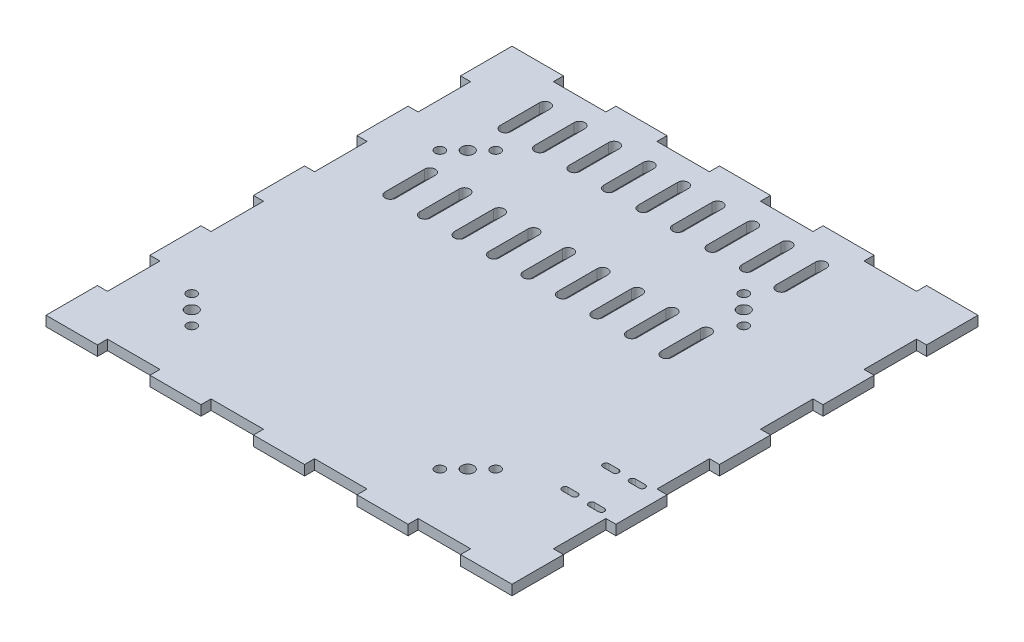
from build123d import *

# Parameters (mm, degrees)
SKETCH2_W           = 130
SKETCH2_H           = 130
SKETCH2_R           = 1.7
BOSS_EXTRUDE1_DEPTH = 2.8
CUT_EXTRUDE2_REACH  = 102.713
SKETCH5_R           = 1.35
SKETCH4_W           = 2.8
SKETCH4_H           = 14.444444445
SKETCH4_W_2         = 14.444444445
SKETCH4_H_2         = 2.8
CUT_EXTRUDE1_DEPTH  = 101.713020509
CUT_EXTRUDE3_REACH  = 102.713
CUT_EXTRUDE4_REACH  = 102.713
TOLERANCE_BY        = 0.1
TOLERANCE_2_BY      = 0.1
TOLERANCE_3_BY      = 0.1
TOLERANCE_4_BY      = 0.1
TOLERANCE_5_BY      = 0.1
TOLERANCE_6_BY      = 0.1
TOLERANCE_7_BY      = 0.1
TOLERANCE_8_BY      = 0.1
TOLERANCE_9_BY      = 0.1
TOLERANCE_10_BY     = 0.1
TOLERANCE_11_BY     = 0.1
TOLERANCE_12_BY     = 0.1
TOLERANCE_13_BY     = 0.1
TOLERANCE_14_BY     = 0.1
TOLERANCE_15_BY     = 0.1
TOLERANCE_16_BY     = 0.1
TOLERANCE_17_BY     = 0.1
TOLERANCE_18_BY     = 0.1
TOLERANCE_19_BY     = 0.1
TOLERANCE_20_BY     = 0.1
TOLERANCE_21_BY     = 0.1
TOLERANCE_22_BY     = 0.1
TOLERANCE_23_BY     = 0.1
TOLERANCE_24_BY     = 0.1
TOLERANCE_25_BY     = 0.1
TOLERANCE_26_BY     = 0.1
TOLERANCE_27_BY     = 0.1
TOLERANCE_28_BY     = 0.1
TOLERANCE_29_BY     = 0.1
TOLERANCE_30_BY     = 0.1
TOLERANCE_31_BY     = 0.1
TOLERANCE_32_BY     = 0.1


with BuildPart() as part:
    # Sketch2 → Boss-Extrude1 (new body)
    with BuildSketch(Plane(origin=(0, 0, 0), x_dir=(1, 0, 0), z_dir=(0, 1, 0))):
        with Locations((7.5, 4.85)):
            Rectangle(SKETCH2_W, SKETCH2_H)
        with Locations((-38.5, 38.5)):
            Circle(SKETCH2_R, mode=Mode.SUBTRACT)
        with Locations((-38.5, -38.5)):
            Circle(SKETCH2_R, mode=Mode.SUBTRACT)
        with Locations((38.5, -38.5)):
            Circle(SKETCH2_R, mode=Mode.SUBTRACT)
        with Locations((38.5, 38.5)):
            Circle(SKETCH2_R, mode=Mode.SUBTRACT)
    extrude(amount=BOSS_EXTRUDE1_DEPTH)

    # Sketch5 → Cut-Extrude2 (cut, up to next)
    with BuildSketch(Plane(origin=(0, 2.8, 0), x_dir=(1, 0, 0), z_dir=(0, 1, 0)), mode=Mode.PRIVATE) as cut_extrude2_sk1:
        with Locations((42.389087297, 34.610912703)):
            Circle(SKETCH5_R)
    cut_extrude2_tool1 = extrude(cut_extrude2_sk1.sketch, amount=-CUT_EXTRUDE2_REACH, mode=Mode.PRIVATE) & part.part
    # Sketch5 → Cut-Extrude2 (cut, up to next)
    with BuildSketch(Plane(origin=(0, 2.8, 0), x_dir=(1, 0, 0), z_dir=(0, 1, 0)), mode=Mode.PRIVATE) as cut_extrude2_sk2:
        with Locations((34.610912703, 42.389087297)):
            Circle(SKETCH5_R)
    cut_extrude2_tool2 = extrude(cut_extrude2_sk2.sketch, amount=-CUT_EXTRUDE2_REACH, mode=Mode.PRIVATE) & part.part
    # Sketch5 → Cut-Extrude2 (cut, up to next)
    with BuildSketch(Plane(origin=(0, 2.8, 0), x_dir=(1, 0, 0), z_dir=(0, 1, 0)), mode=Mode.PRIVATE) as cut_extrude2_sk3:
        with Locations((34.610912703, -42.389087297)):
            Circle(SKETCH5_R)
    cut_extrude2_tool3 = extrude(cut_extrude2_sk3.sketch, amount=-CUT_EXTRUDE2_REACH, mode=Mode.PRIVATE) & part.part
    # Sketch5 → Cut-Extrude2 (cut, up to next)
    with BuildSketch(Plane(origin=(0, 2.8, 0), x_dir=(1, 0, 0), z_dir=(0, 1, 0)), mode=Mode.PRIVATE) as cut_extrude2_sk4:
        with Locations((42.389087297, -34.610912703)):
            Circle(SKETCH5_R)
    cut_extrude2_tool4 = extrude(cut_extrude2_sk4.sketch, amount=-CUT_EXTRUDE2_REACH, mode=Mode.PRIVATE) & part.part
    # Sketch5 → Cut-Extrude2 (cut, up to next)
    with BuildSketch(Plane(origin=(0, 2.8, 0), x_dir=(1, 0, 0), z_dir=(0, 1, 0)), mode=Mode.PRIVATE) as cut_extrude2_sk5:
        with Locations((-42.389087297, -34.610912703)):
            Circle(SKETCH5_R)
    cut_extrude2_tool5 = extrude(cut_extrude2_sk5.sketch, amount=-CUT_EXTRUDE2_REACH, mode=Mode.PRIVATE) & part.part
    # Sketch5 → Cut-Extrude2 (cut, up to next)
    with BuildSketch(Plane(origin=(0, 2.8, 0), x_dir=(1, 0, 0), z_dir=(0, 1, 0)), mode=Mode.PRIVATE) as cut_extrude2_sk6:
        with Locations((-34.610912703, -42.389087297)):
            Circle(SKETCH5_R)
    cut_extrude2_tool6 = extrude(cut_extrude2_sk6.sketch, amount=-CUT_EXTRUDE2_REACH, mode=Mode.PRIVATE) & part.part
    # Sketch5 → Cut-Extrude2 (cut, up to next)
    with BuildSketch(Plane(origin=(0, 2.8, 0), x_dir=(1, 0, 0), z_dir=(0, 1, 0)), mode=Mode.PRIVATE) as cut_extrude2_sk7:
        with Locations((-34.610912703, 42.389087297)):
            Circle(SKETCH5_R)
    cut_extrude2_tool7 = extrude(cut_extrude2_sk7.sketch, amount=-CUT_EXTRUDE2_REACH, mode=Mode.PRIVATE) & part.part
    # Sketch5 → Cut-Extrude2 (cut, up to next)
    with BuildSketch(Plane(origin=(0, 2.8, 0), x_dir=(1, 0, 0), z_dir=(0, 1, 0)), mode=Mode.PRIVATE) as cut_extrude2_sk8:
        with Locations((-42.389087297, 34.610912703)):
            Circle(SKETCH5_R)
    cut_extrude2_tool8 = extrude(cut_extrude2_sk8.sketch, amount=-CUT_EXTRUDE2_REACH, mode=Mode.PRIVATE) & part.part
    add(cut_extrude2_tool1.solids().sort_by_distance((42.389087, 2.8, -34.610913))[0], mode=Mode.SUBTRACT)
    add(cut_extrude2_tool2.solids().sort_by_distance((34.610913, 2.8, -42.389087))[0], mode=Mode.SUBTRACT)
    add(cut_extrude2_tool3.solids().sort_by_distance((34.610913, 2.8, 42.389087))[0], mode=Mode.SUBTRACT)
    add(cut_extrude2_tool4.solids().sort_by_distance((42.389087, 2.8, 34.610913))[0], mode=Mode.SUBTRACT)
    add(cut_extrude2_tool5.solids().sort_by_distance((-42.389087, 2.8, 34.610913))[0], mode=Mode.SUBTRACT)
    add(cut_extrude2_tool6.solids().sort_by_distance((-34.610913, 2.8, 42.389087))[0], mode=Mode.SUBTRACT)
    add(cut_extrude2_tool7.solids().sort_by_distance((-34.610913, 2.8, -42.389087))[0], mode=Mode.SUBTRACT)
    add(cut_extrude2_tool8.solids().sort_by_distance((-42.389087, 2.8, -34.610913))[0], mode=Mode.SUBTRACT)

    # Sketch4 → Cut-Extrude1 (cut, through all)
    with BuildSketch(Plane(origin=(0, 2.8, 0), x_dir=(1, 0, 0), z_dir=(0, 1, 0))):
        with Locations((71.1, 48.183333334)):
            Rectangle(SKETCH4_W, SKETCH4_H)
        with Locations((71.1, 19.294444445)):
            Rectangle(SKETCH4_W, SKETCH4_H)
        with Locations((71.1, -9.594444445)):
            Rectangle(SKETCH4_W, SKETCH4_H)
        with Locations((71.1, -38.483333333)):
            Rectangle(SKETCH4_W, SKETCH4_H)
        with Locations((-35.833333334, -58.75)):
            Rectangle(SKETCH4_W_2, SKETCH4_H_2)
        with Locations((-6.944444445, -58.75)):
            Rectangle(SKETCH4_W_2, SKETCH4_H_2)
        with Locations((21.944444445, -58.75)):
            Rectangle(SKETCH4_W_2, SKETCH4_H_2)
        with Locations((50.833333334, -58.75)):
            Rectangle(SKETCH4_W_2, SKETCH4_H_2)
        with Locations((-56.1, 48.183333334)):
            Rectangle(SKETCH4_W, SKETCH4_H)
        with Locations((-56.1, 19.294444445)):
            Rectangle(SKETCH4_W, SKETCH4_H)
        with Locations((-56.1, -9.594444445)):
            Rectangle(SKETCH4_W, SKETCH4_H)
        with Locations((-56.1, -38.483333333)):
            Rectangle(SKETCH4_W, SKETCH4_H)
        with Locations((50.833333334, 68.45)):
            Rectangle(SKETCH4_W_2, SKETCH4_H_2)
        with Locations((21.944444445, 68.45)):
            Rectangle(SKETCH4_W_2, SKETCH4_H_2)
        with Locations((-6.944444445, 68.45)):
            Rectangle(SKETCH4_W_2, SKETCH4_H_2)
        with Locations((-35.833333334, 68.45)):
            Rectangle(SKETCH4_W_2, SKETCH4_H_2)
    extrude(amount=-CUT_EXTRUDE1_DEPTH, mode=Mode.SUBTRACT)

    # Sketch6 → Cut-Extrude3 (cut, up to next)
    with BuildSketch(Plane(origin=(0, 2.8, 0), x_dir=(1, 0, 0), z_dir=(0, 1, 0)), mode=Mode.PRIVATE) as cut_extrude3_sk1:
        with BuildLine():
            Line((67, -30.588888889), (64.3, -30.588888889))
            ThreePointArc((64.3, -30.588888889), (63.45, -29.738888889), (64.3, -28.888888889))
            Line((64.3, -28.888888889), (67, -28.888888889))
            ThreePointArc((67, -28.888888889), (67.85, -29.738888889), (67, -30.588888889))
        make_face()
    cut_extrude3_tool1 = extrude(cut_extrude3_sk1.sketch, amount=-CUT_EXTRUDE3_REACH, mode=Mode.PRIVATE) & part.part
    # Sketch6 → Cut-Extrude3 (cut, up to next)
    with BuildSketch(Plane(origin=(0, 2.8, 0), x_dir=(1, 0, 0), z_dir=(0, 1, 0)), mode=Mode.PRIVATE) as cut_extrude3_sk2:
        with BuildLine():
            Line((59.6, -30.588888889), (56.9, -30.588888889))
            ThreePointArc((56.9, -30.588888889), (56.05, -29.738888889), (56.9, -28.888888889))
            Line((56.9, -28.888888889), (59.6, -28.888888889))
            ThreePointArc((59.6, -28.888888889), (60.45, -29.738888889), (59.6, -30.588888889))
        make_face()
    cut_extrude3_tool2 = extrude(cut_extrude3_sk2.sketch, amount=-CUT_EXTRUDE3_REACH, mode=Mode.PRIVATE) & part.part
    # Sketch6 → Cut-Extrude3 (cut, up to next)
    with BuildSketch(Plane(origin=(0, 2.8, 0), x_dir=(1, 0, 0), z_dir=(0, 1, 0)), mode=Mode.PRIVATE) as cut_extrude3_sk3:
        with BuildLine():
            Line((59.6, -17.488888889), (56.9, -17.488888889))
            ThreePointArc((56.9, -17.488888889), (56.05, -18.338888889), (56.9, -19.188888889))
            Line((56.9, -19.188888889), (59.6, -19.188888889))
            ThreePointArc((59.6, -19.188888889), (60.45, -18.338888889), (59.6, -17.488888889))
        make_face()
    cut_extrude3_tool3 = extrude(cut_extrude3_sk3.sketch, amount=-CUT_EXTRUDE3_REACH, mode=Mode.PRIVATE) & part.part
    # Sketch6 → Cut-Extrude3 (cut, up to next)
    with BuildSketch(Plane(origin=(0, 2.8, 0), x_dir=(1, 0, 0), z_dir=(0, 1, 0)), mode=Mode.PRIVATE) as cut_extrude3_sk4:
        with BuildLine():
            Line((67, -17.488888889), (64.3, -17.488888889))
            ThreePointArc((64.3, -17.488888889), (63.45, -18.338888889), (64.3, -19.188888889))
            Line((64.3, -19.188888889), (67, -19.188888889))
            ThreePointArc((67, -19.188888889), (67.85, -18.338888889), (67, -17.488888889))
        make_face()
    cut_extrude3_tool4 = extrude(cut_extrude3_sk4.sketch, amount=-CUT_EXTRUDE3_REACH, mode=Mode.PRIVATE) & part.part
    add(cut_extrude3_tool1.solids().sort_by_distance((65.65, 2.8, 29.738889))[0], mode=Mode.SUBTRACT)
    add(cut_extrude3_tool2.solids().sort_by_distance((58.25, 2.8, 29.738889))[0], mode=Mode.SUBTRACT)
    add(cut_extrude3_tool3.solids().sort_by_distance((58.25, 2.8, 18.338889))[0], mode=Mode.SUBTRACT)
    add(cut_extrude3_tool4.solids().sort_by_distance((65.65, 2.8, 18.338889))[0], mode=Mode.SUBTRACT)

    # Sketch7 → Cut-Extrude4 (cut, up to next)
    with BuildSketch(Plane(origin=(0, 2.8, 0), x_dir=(1, 0, 0), z_dir=(0, 1, 0)), mode=Mode.PRIVATE) as cut_extrude4_sk1:
        with BuildLine():
            Line((-37, 60.05), (-37, 49.05))
            ThreePointArc((-37, 49.05), (-38.5, 47.55), (-40, 49.05))
            Line((-40, 49.05), (-40, 60.05))
            ThreePointArc((-40, 60.05), (-38.5, 61.55), (-37, 60.05))
        make_face()
    cut_extrude4_tool1 = extrude(cut_extrude4_sk1.sketch, amount=-CUT_EXTRUDE4_REACH, mode=Mode.PRIVATE) & part.part
    # Sketch7 → Cut-Extrude4 (cut, up to next)
    with BuildSketch(Plane(origin=(0, 2.8, 0), x_dir=(1, 0, 0), z_dir=(0, 1, 0)), mode=Mode.PRIVATE) as cut_extrude4_sk2:
        with BuildLine():
            Line((-30.375, 60.05), (-30.375, 49.05))
            ThreePointArc((-30.375, 49.05), (-28.875, 47.55), (-27.375, 49.05))
            Line((-27.375, 49.05), (-27.375, 60.05))
            ThreePointArc((-27.375, 60.05), (-28.875, 61.55), (-30.375, 60.05))
        make_face()
    cut_extrude4_tool2 = extrude(cut_extrude4_sk2.sketch, amount=-CUT_EXTRUDE4_REACH, mode=Mode.PRIVATE) & part.part
    # Sketch7 → Cut-Extrude4 (cut, up to next)
    with BuildSketch(Plane(origin=(0, 2.8, 0), x_dir=(1, 0, 0), z_dir=(0, 1, 0)), mode=Mode.PRIVATE) as cut_extrude4_sk3:
        with BuildLine():
            Line((-20.75, 60.05), (-20.75, 49.05))
            ThreePointArc((-20.75, 49.05), (-19.25, 47.55), (-17.75, 49.05))
            Line((-17.75, 49.05), (-17.75, 60.05))
            ThreePointArc((-17.75, 60.05), (-19.25, 61.55), (-20.75, 60.05))
        make_face()
    cut_extrude4_tool3 = extrude(cut_extrude4_sk3.sketch, amount=-CUT_EXTRUDE4_REACH, mode=Mode.PRIVATE) & part.part
    # Sketch7 → Cut-Extrude4 (cut, up to next)
    with BuildSketch(Plane(origin=(0, 2.8, 0), x_dir=(1, 0, 0), z_dir=(0, 1, 0)), mode=Mode.PRIVATE) as cut_extrude4_sk4:
        with BuildLine():
            Line((-11.125, 60.05), (-11.125, 49.05))
            ThreePointArc((-11.125, 49.05), (-9.625, 47.55), (-8.125, 49.05))
            Line((-8.125, 49.05), (-8.125, 60.05))
            ThreePointArc((-8.125, 60.05), (-9.625, 61.55), (-11.125, 60.05))
        make_face()
    cut_extrude4_tool4 = extrude(cut_extrude4_sk4.sketch, amount=-CUT_EXTRUDE4_REACH, mode=Mode.PRIVATE) & part.part
    # Sketch7 → Cut-Extrude4 (cut, up to next)
    with BuildSketch(Plane(origin=(0, 2.8, 0), x_dir=(1, 0, 0), z_dir=(0, 1, 0)), mode=Mode.PRIVATE) as cut_extrude4_sk5:
        with BuildLine():
            Line((-1.5, 60.05), (-1.5, 49.05))
            ThreePointArc((-1.5, 49.05), (0, 47.55), (1.5, 49.05))
            Line((1.5, 49.05), (1.5, 60.05))
            ThreePointArc((1.5, 60.05), (0, 61.55), (-1.5, 60.05))
        make_face()
    cut_extrude4_tool5 = extrude(cut_extrude4_sk5.sketch, amount=-CUT_EXTRUDE4_REACH, mode=Mode.PRIVATE) & part.part
    # Sketch7 → Cut-Extrude4 (cut, up to next)
    with BuildSketch(Plane(origin=(0, 2.8, 0), x_dir=(1, 0, 0), z_dir=(0, 1, 0)), mode=Mode.PRIVATE) as cut_extrude4_sk6:
        with BuildLine():
            Line((8.125, 60.05), (8.125, 49.05))
            ThreePointArc((8.125, 49.05), (9.625, 47.55), (11.125, 49.05))
            Line((11.125, 49.05), (11.125, 60.05))
            ThreePointArc((11.125, 60.05), (9.625, 61.55), (8.125, 60.05))
        make_face()
    cut_extrude4_tool6 = extrude(cut_extrude4_sk6.sketch, amount=-CUT_EXTRUDE4_REACH, mode=Mode.PRIVATE) & part.part
    # Sketch7 → Cut-Extrude4 (cut, up to next)
    with BuildSketch(Plane(origin=(0, 2.8, 0), x_dir=(1, 0, 0), z_dir=(0, 1, 0)), mode=Mode.PRIVATE) as cut_extrude4_sk7:
        with BuildLine():
            Line((17.75, 60.05), (17.75, 49.05))
            ThreePointArc((17.75, 49.05), (19.25, 47.55), (20.75, 49.05))
            Line((20.75, 49.05), (20.75, 60.05))
            ThreePointArc((20.75, 60.05), (19.25, 61.55), (17.75, 60.05))
        make_face()
    cut_extrude4_tool7 = extrude(cut_extrude4_sk7.sketch, amount=-CUT_EXTRUDE4_REACH, mode=Mode.PRIVATE) & part.part
    # Sketch7 → Cut-Extrude4 (cut, up to next)
    with BuildSketch(Plane(origin=(0, 2.8, 0), x_dir=(1, 0, 0), z_dir=(0, 1, 0)), mode=Mode.PRIVATE) as cut_extrude4_sk8:
        with BuildLine():
            Line((27.375, 60.05), (27.375, 49.05))
            ThreePointArc((27.375, 49.05), (28.875, 47.55), (30.375, 49.05))
            Line((30.375, 49.05), (30.375, 60.05))
            ThreePointArc((30.375, 60.05), (28.875, 61.55), (27.375, 60.05))
        make_face()
    cut_extrude4_tool8 = extrude(cut_extrude4_sk8.sketch, amount=-CUT_EXTRUDE4_REACH, mode=Mode.PRIVATE) & part.part
    # Sketch7 → Cut-Extrude4 (cut, up to next)
    with BuildSketch(Plane(origin=(0, 2.8, 0), x_dir=(1, 0, 0), z_dir=(0, 1, 0)), mode=Mode.PRIVATE) as cut_extrude4_sk9:
        with BuildLine():
            Line((37, 60.05), (37, 49.05))
            ThreePointArc((37, 49.05), (38.5, 47.55), (40, 49.05))
            Line((40, 49.05), (40, 60.05))
            ThreePointArc((40, 60.05), (38.5, 61.55), (37, 60.05))
        make_face()
    cut_extrude4_tool9 = extrude(cut_extrude4_sk9.sketch, amount=-CUT_EXTRUDE4_REACH, mode=Mode.PRIVATE) & part.part
    # Sketch7 → Cut-Extrude4 (cut, up to next)
    with BuildSketch(Plane(origin=(0, 2.8, 0), x_dir=(1, 0, 0), z_dir=(0, 1, 0)), mode=Mode.PRIVATE) as cut_extrude4_sk10:
        with BuildLine():
            Line((-40, 27.95), (-40, 16.95))
            ThreePointArc((-40, 16.95), (-38.5, 15.45), (-37, 16.95))
            Line((-37, 16.95), (-37, 27.95))
            ThreePointArc((-37, 27.95), (-38.5, 29.45), (-40, 27.95))
        make_face()
    cut_extrude4_tool10 = extrude(cut_extrude4_sk10.sketch, amount=-CUT_EXTRUDE4_REACH, mode=Mode.PRIVATE) & part.part
    # Sketch7 → Cut-Extrude4 (cut, up to next)
    with BuildSketch(Plane(origin=(0, 2.8, 0), x_dir=(1, 0, 0), z_dir=(0, 1, 0)), mode=Mode.PRIVATE) as cut_extrude4_sk11:
        with BuildLine():
            Line((-30.375, 27.95), (-30.375, 16.95))
            ThreePointArc((-30.375, 16.95), (-28.875, 15.45), (-27.375, 16.95))
            Line((-27.375, 16.95), (-27.375, 27.95))
            ThreePointArc((-27.375, 27.95), (-28.875, 29.45), (-30.375, 27.95))
        make_face()
    cut_extrude4_tool11 = extrude(cut_extrude4_sk11.sketch, amount=-CUT_EXTRUDE4_REACH, mode=Mode.PRIVATE) & part.part
    # Sketch7 → Cut-Extrude4 (cut, up to next)
    with BuildSketch(Plane(origin=(0, 2.8, 0), x_dir=(1, 0, 0), z_dir=(0, 1, 0)), mode=Mode.PRIVATE) as cut_extrude4_sk12:
        with BuildLine():
            Line((-20.75, 27.95), (-20.75, 16.95))
            ThreePointArc((-20.75, 16.95), (-19.25, 15.45), (-17.75, 16.95))
            Line((-17.75, 16.95), (-17.75, 27.95))
            ThreePointArc((-17.75, 27.95), (-19.25, 29.45), (-20.75, 27.95))
        make_face()
    cut_extrude4_tool12 = extrude(cut_extrude4_sk12.sketch, amount=-CUT_EXTRUDE4_REACH, mode=Mode.PRIVATE) & part.part
    # Sketch7 → Cut-Extrude4 (cut, up to next)
    with BuildSketch(Plane(origin=(0, 2.8, 0), x_dir=(1, 0, 0), z_dir=(0, 1, 0)), mode=Mode.PRIVATE) as cut_extrude4_sk13:
        with BuildLine():
            Line((-11.125, 27.95), (-11.125, 16.95))
            ThreePointArc((-11.125, 16.95), (-9.625, 15.45), (-8.125, 16.95))
            Line((-8.125, 16.95), (-8.125, 27.95))
            ThreePointArc((-8.125, 27.95), (-9.625, 29.45), (-11.125, 27.95))
        make_face()
    cut_extrude4_tool13 = extrude(cut_extrude4_sk13.sketch, amount=-CUT_EXTRUDE4_REACH, mode=Mode.PRIVATE) & part.part
    # Sketch7 → Cut-Extrude4 (cut, up to next)
    with BuildSketch(Plane(origin=(0, 2.8, 0), x_dir=(1, 0, 0), z_dir=(0, 1, 0)), mode=Mode.PRIVATE) as cut_extrude4_sk14:
        with BuildLine():
            Line((-1.5, 27.95), (-1.5, 16.95))
            ThreePointArc((-1.5, 16.95), (0, 15.45), (1.5, 16.95))
            Line((1.5, 16.95), (1.5, 27.95))
            ThreePointArc((1.5, 27.95), (0, 29.45), (-1.5, 27.95))
        make_face()
    cut_extrude4_tool14 = extrude(cut_extrude4_sk14.sketch, amount=-CUT_EXTRUDE4_REACH, mode=Mode.PRIVATE) & part.part
    # Sketch7 → Cut-Extrude4 (cut, up to next)
    with BuildSketch(Plane(origin=(0, 2.8, 0), x_dir=(1, 0, 0), z_dir=(0, 1, 0)), mode=Mode.PRIVATE) as cut_extrude4_sk15:
        with BuildLine():
            Line((8.125, 27.95), (8.125, 16.95))
            ThreePointArc((8.125, 16.95), (9.625, 15.45), (11.125, 16.95))
            Line((11.125, 16.95), (11.125, 27.95))
            ThreePointArc((11.125, 27.95), (9.625, 29.45), (8.125, 27.95))
        make_face()
    cut_extrude4_tool15 = extrude(cut_extrude4_sk15.sketch, amount=-CUT_EXTRUDE4_REACH, mode=Mode.PRIVATE) & part.part
    # Sketch7 → Cut-Extrude4 (cut, up to next)
    with BuildSketch(Plane(origin=(0, 2.8, 0), x_dir=(1, 0, 0), z_dir=(0, 1, 0)), mode=Mode.PRIVATE) as cut_extrude4_sk16:
        with BuildLine():
            Line((17.75, 27.95), (17.75, 16.95))
            ThreePointArc((17.75, 16.95), (19.25, 15.45), (20.75, 16.95))
            Line((20.75, 16.95), (20.75, 27.95))
            ThreePointArc((20.75, 27.95), (19.25, 29.45), (17.75, 27.95))
        make_face()
    cut_extrude4_tool16 = extrude(cut_extrude4_sk16.sketch, amount=-CUT_EXTRUDE4_REACH, mode=Mode.PRIVATE) & part.part
    # Sketch7 → Cut-Extrude4 (cut, up to next)
    with BuildSketch(Plane(origin=(0, 2.8, 0), x_dir=(1, 0, 0), z_dir=(0, 1, 0)), mode=Mode.PRIVATE) as cut_extrude4_sk17:
        with BuildLine():
            Line((27.375, 27.95), (27.375, 16.95))
            ThreePointArc((27.375, 16.95), (28.875, 15.45), (30.375, 16.95))
            Line((30.375, 16.95), (30.375, 27.95))
            ThreePointArc((30.375, 27.95), (28.875, 29.45), (27.375, 27.95))
        make_face()
    cut_extrude4_tool17 = extrude(cut_extrude4_sk17.sketch, amount=-CUT_EXTRUDE4_REACH, mode=Mode.PRIVATE) & part.part
    # Sketch7 → Cut-Extrude4 (cut, up to next)
    with BuildSketch(Plane(origin=(0, 2.8, 0), x_dir=(1, 0, 0), z_dir=(0, 1, 0)), mode=Mode.PRIVATE) as cut_extrude4_sk18:
        with BuildLine():
            Line((37, 27.95), (37, 16.95))
            ThreePointArc((37, 16.95), (38.5, 15.45), (40, 16.95))
            Line((40, 16.95), (40, 27.95))
            ThreePointArc((40, 27.95), (38.5, 29.45), (37, 27.95))
        make_face()
    cut_extrude4_tool18 = extrude(cut_extrude4_sk18.sketch, amount=-CUT_EXTRUDE4_REACH, mode=Mode.PRIVATE) & part.part
    add(cut_extrude4_tool1.solids().sort_by_distance((-38.5, 2.8, -54.55))[0], mode=Mode.SUBTRACT)
    add(cut_extrude4_tool2.solids().sort_by_distance((-28.875, 2.8, -54.55))[0], mode=Mode.SUBTRACT)
    add(cut_extrude4_tool3.solids().sort_by_distance((-19.25, 2.8, -54.55))[0], mode=Mode.SUBTRACT)
    add(cut_extrude4_tool4.solids().sort_by_distance((-9.625, 2.8, -54.55))[0], mode=Mode.SUBTRACT)
    add(cut_extrude4_tool5.solids().sort_by_distance((0, 2.8, -54.55))[0], mode=Mode.SUBTRACT)
    add(cut_extrude4_tool6.solids().sort_by_distance((9.625, 2.8, -54.55))[0], mode=Mode.SUBTRACT)
    add(cut_extrude4_tool7.solids().sort_by_distance((19.25, 2.8, -54.55))[0], mode=Mode.SUBTRACT)
    add(cut_extrude4_tool8.solids().sort_by_distance((28.875, 2.8, -54.55))[0], mode=Mode.SUBTRACT)
    add(cut_extrude4_tool9.solids().sort_by_distance((38.5, 2.8, -54.55))[0], mode=Mode.SUBTRACT)
    add(cut_extrude4_tool10.solids().sort_by_distance((-38.5, 2.8, -22.45))[0], mode=Mode.SUBTRACT)
    add(cut_extrude4_tool11.solids().sort_by_distance((-28.875, 2.8, -22.45))[0], mode=Mode.SUBTRACT)
    add(cut_extrude4_tool12.solids().sort_by_distance((-19.25, 2.8, -22.45))[0], mode=Mode.SUBTRACT)
    add(cut_extrude4_tool13.solids().sort_by_distance((-9.625, 2.8, -22.45))[0], mode=Mode.SUBTRACT)
    add(cut_extrude4_tool14.solids().sort_by_distance((0, 2.8, -22.45))[0], mode=Mode.SUBTRACT)
    add(cut_extrude4_tool15.solids().sort_by_distance((9.625, 2.8, -22.45))[0], mode=Mode.SUBTRACT)
    add(cut_extrude4_tool16.solids().sort_by_distance((19.25, 2.8, -22.45))[0], mode=Mode.SUBTRACT)
    add(cut_extrude4_tool17.solids().sort_by_distance((28.875, 2.8, -22.45))[0], mode=Mode.SUBTRACT)
    add(cut_extrude4_tool18.solids().sort_by_distance((38.5, 2.8, -22.45))[0], mode=Mode.SUBTRACT)

    # Tolerance: a face moved inward by 0.1
    extrude(part.faces().sort_by_distance((43.611111111, 1.4, -68.45))[0], amount=TOLERANCE_BY, dir=(-1, 0, 0), mode=Mode.SUBTRACT)

    # Tolerance 2: a face moved inward by 0.1
    extrude(part.faces().sort_by_distance((14.722222222, 1.4, -68.45))[0], amount=TOLERANCE_2_BY, dir=(-1, 0, 0), mode=Mode.SUBTRACT)

    # Tolerance 3: a face moved inward by 0.1
    extrude(part.faces().sort_by_distance((-14.166666667, 1.4, -68.45))[0], amount=TOLERANCE_3_BY, dir=(-1, 0, 0), mode=Mode.SUBTRACT)

    # Tolerance 4: a face moved inward by 0.1
    extrude(part.faces().sort_by_distance((-43.055555556, 1.4, -68.45))[0], amount=TOLERANCE_4_BY, dir=(-1, 0, 0), mode=Mode.SUBTRACT)

    # Tolerance 5: a face moved inward by 0.1
    extrude(part.faces().sort_by_distance((29.166666667, 1.4, -68.45))[0], amount=TOLERANCE_5_BY, dir=(1, 0, 0), mode=Mode.SUBTRACT)

    # Tolerance 6: a face moved inward by 0.1
    extrude(part.faces().sort_by_distance((58.055555556, 1.4, -68.45))[0], amount=TOLERANCE_6_BY, dir=(1, 0, 0), mode=Mode.SUBTRACT)

    # Tolerance 7: a face moved inward by 0.1
    extrude(part.faces().sort_by_distance((0.277777778, 1.4, -68.45))[0], amount=TOLERANCE_7_BY, dir=(1, 0, 0), mode=Mode.SUBTRACT)

    # Tolerance 8: a face moved inward by 0.1
    extrude(part.faces().sort_by_distance((-28.611111111, 1.4, -68.45))[0], amount=TOLERANCE_8_BY, dir=(1, 0, 0), mode=Mode.SUBTRACT)

    # Tolerance 9: a face moved inward by 0.1
    extrude(part.faces().sort_by_distance((-56.1, 1.4, -40.961111111))[0], amount=TOLERANCE_9_BY, dir=(0, 0, 1), mode=Mode.SUBTRACT)

    # Tolerance 10: a face moved inward by 0.1
    extrude(part.faces().sort_by_distance((-56.1, 1.4, -55.405555556))[0], amount=TOLERANCE_10_BY, dir=(0, 0, -1), mode=Mode.SUBTRACT)

    # Tolerance 11: a face moved inward by 0.1
    extrude(part.faces().sort_by_distance((-56.1, 1.4, -12.072222222))[0], amount=TOLERANCE_11_BY, dir=(0, 0, 1), mode=Mode.SUBTRACT)

    # Tolerance 12: a face moved inward by 0.1
    extrude(part.faces().sort_by_distance((-56.1, 1.4, -26.516666667))[0], amount=TOLERANCE_12_BY, dir=(0, 0, -1), mode=Mode.SUBTRACT)

    # Tolerance 13: a face moved inward by 0.1
    extrude(part.faces().sort_by_distance((-56.1, 1.4, 2.372222222))[0], amount=TOLERANCE_13_BY, dir=(0, 0, -1), mode=Mode.SUBTRACT)

    # Tolerance 14: a face moved inward by 0.1
    extrude(part.faces().sort_by_distance((-56.1, 1.4, 16.816666667))[0], amount=TOLERANCE_14_BY, dir=(0, 0, 1), mode=Mode.SUBTRACT)

    # Tolerance 15: a face moved inward by 0.1
    extrude(part.faces().sort_by_distance((-56.1, 1.4, 45.705555556))[0], amount=TOLERANCE_15_BY, dir=(0, 0, 1), mode=Mode.SUBTRACT)

    # Tolerance 16: a face moved inward by 0.1
    extrude(part.faces().sort_by_distance((-56.1, 1.4, 31.261111111))[0], amount=TOLERANCE_16_BY, dir=(0, 0, -1), mode=Mode.SUBTRACT)

    # Tolerance 17: a face moved inward by 0.1
    extrude(part.faces().sort_by_distance((-28.611111111, 1.4, 58.75))[0], amount=TOLERANCE_17_BY, dir=(1, 0, 0), mode=Mode.SUBTRACT)

    # Tolerance 18: a face moved inward by 0.1
    extrude(part.faces().sort_by_distance((-43.055555556, 1.4, 58.75))[0], amount=TOLERANCE_18_BY, dir=(-1, 0, 0), mode=Mode.SUBTRACT)

    # Tolerance 19: a face moved inward by 0.1
    extrude(part.faces().sort_by_distance((-14.166666667, 1.4, 58.75))[0], amount=TOLERANCE_19_BY, dir=(-1, 0, 0), mode=Mode.SUBTRACT)

    # Tolerance 20: a face moved inward by 0.1
    extrude(part.faces().sort_by_distance((0.277777778, 1.4, 58.75))[0], amount=TOLERANCE_20_BY, dir=(1, 0, 0), mode=Mode.SUBTRACT)

    # Tolerance 21: a face moved inward by 0.1
    extrude(part.faces().sort_by_distance((14.722222222, 1.4, 58.75))[0], amount=TOLERANCE_21_BY, dir=(-1, 0, 0), mode=Mode.SUBTRACT)

    # Tolerance 22: a face moved inward by 0.1
    extrude(part.faces().sort_by_distance((29.166666667, 1.4, 58.75))[0], amount=TOLERANCE_22_BY, dir=(1, 0, 0), mode=Mode.SUBTRACT)

    # Tolerance 23: a face moved inward by 0.1
    extrude(part.faces().sort_by_distance((58.055555556, 1.4, 58.75))[0], amount=TOLERANCE_23_BY, dir=(1, 0, 0), mode=Mode.SUBTRACT)

    # Tolerance 24: a face moved inward by 0.1
    extrude(part.faces().sort_by_distance((43.611111111, 1.4, 58.75))[0], amount=TOLERANCE_24_BY, dir=(-1, 0, 0), mode=Mode.SUBTRACT)

    # Tolerance 25: a face moved inward by 0.1
    extrude(part.faces().sort_by_distance((71.1, 1.4, 31.261111111))[0], amount=TOLERANCE_25_BY, dir=(0, 0, -1), mode=Mode.SUBTRACT)

    # Tolerance 26: a face moved inward by 0.1
    extrude(part.faces().sort_by_distance((71.1, 1.4, 45.705555556))[0], amount=TOLERANCE_26_BY, dir=(0, 0, 1), mode=Mode.SUBTRACT)

    # Tolerance 27: a face moved inward by 0.1
    extrude(part.faces().sort_by_distance((71.1, 1.4, 16.816666667))[0], amount=TOLERANCE_27_BY, dir=(0, 0, 1), mode=Mode.SUBTRACT)

    # Tolerance 28: a face moved inward by 0.1
    extrude(part.faces().sort_by_distance((71.1, 1.4, 2.372222222))[0], amount=TOLERANCE_28_BY, dir=(0, 0, -1), mode=Mode.SUBTRACT)

    # Tolerance 29: a face moved inward by 0.1
    extrude(part.faces().sort_by_distance((71.1, 1.4, -12.072222222))[0], amount=TOLERANCE_29_BY, dir=(0, 0, 1), mode=Mode.SUBTRACT)

    # Tolerance 30: a face moved inward by 0.1
    extrude(part.faces().sort_by_distance((71.1, 1.4, -26.516666667))[0], amount=TOLERANCE_30_BY, dir=(0, 0, -1), mode=Mode.SUBTRACT)

    # Tolerance 31: a face moved inward by 0.1
    extrude(part.faces().sort_by_distance((71.1, 1.4, -55.405555556))[0], amount=TOLERANCE_31_BY, dir=(0, 0, -1), mode=Mode.SUBTRACT)

    # Tolerance 32: a face moved inward by 0.1
    extrude(part.faces().sort_by_distance((71.1, 1.4, -40.961111111))[0], amount=TOLERANCE_32_BY, dir=(0, 0, 1), mode=Mode.SUBTRACT)


solid = part.part
